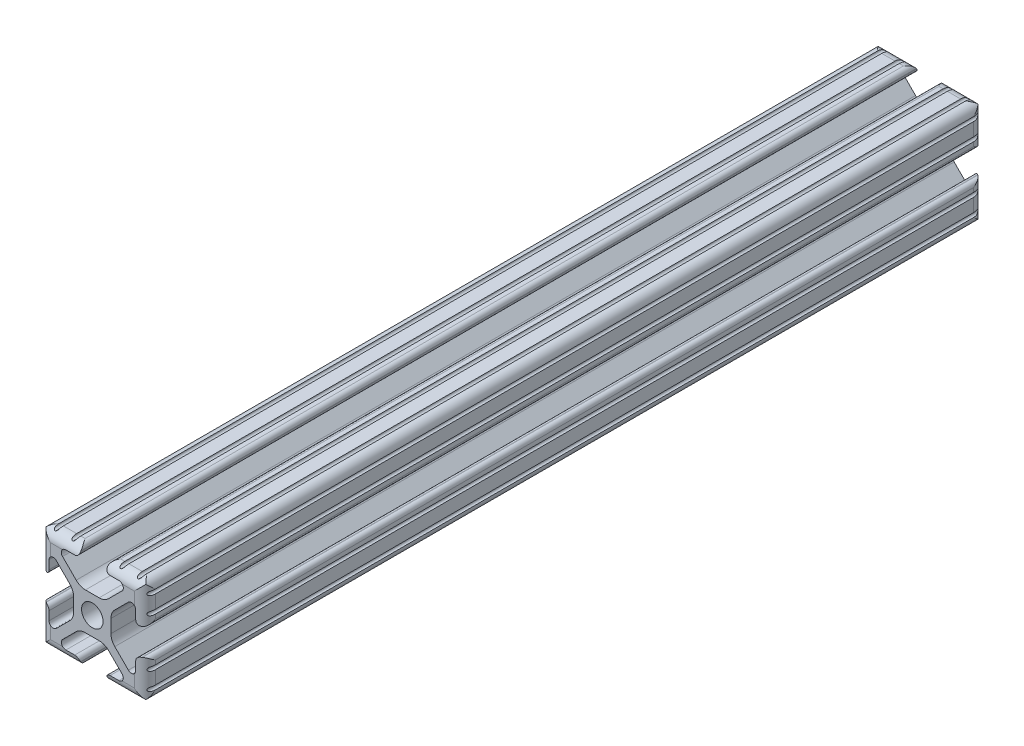
from build123d import *

# Parameters (mm, degrees)
SKETCH1_R           = 2.6035
BOSS_EXTRUDE1_DEPTH = 101.6
FILLET1_R           = 2.54
SKETCH3_R           = 3.175
CUT_EXTRUDE1_DEPTH  = 106.494123191


with BuildPart() as part:
    # Sketch1 → Boss-Extrude1 (new, symmetric)
    with BuildSketch(Plane.XY):
        with BuildLine():
            Line((-7.179650497, -8.645192506), (-3.952270251, -5.423690499))
            ThreePointArc((-3.952270251, -5.423690499), (-2.922936451, -4.736929036), (-1.709253557, -4.4958))
            Line((-1.709253557, -4.4958), (1.709253557, -4.4958))
            ThreePointArc((1.709253557, -4.4958), (2.922936451, -4.736929036), (3.952270251, -5.423690499))
            Line((3.952270251, -5.423690499), (7.179650497, -8.645192506))
            ThreePointArc((7.179650497, -8.645192506), (7.41473083, -9.822813117), (6.416408329, -10.4902))
            Line((6.416408329, -10.4902), (4.287512407, -10.4902))
            ThreePointArc((4.287512407, -10.4902), (3.54574862, -10.79744862), (3.2385, -11.539212407))
            Line((3.2385, -11.539212407), (3.2385, -11.650987593))
            ThreePointArc((3.2385, -11.650987593), (3.54574862, -12.39275138), (4.287512407, -12.7))
            Line((4.287512407, -12.7), (5.317126718, -12.7))
            ThreePointArc((5.317126718, -12.7), (5.825126718, -12.192), (6.333126718, -12.7))
            Line((6.333126718, -12.7), (9.550443118, -12.7))
            ThreePointArc((9.550443118, -12.7), (10.058366869, -12.192000006), (10.566443095, -12.699847501))
            ThreePointArc((10.566443095, -12.699847501), (12.082537762, -12.08250727), (12.699846982, -10.566399977))
            ThreePointArc((12.699846982, -10.566399977), (12.192000006, -10.058323491), (12.7, -9.5504))
            Line((12.7, -9.5504), (12.7, -6.3330836))
            ThreePointArc((12.7, -6.3330836), (12.192, -5.8250836), (12.7, -5.3170836))
            Line((12.7, -5.3170836), (12.7, -4.287469289))
            ThreePointArc((12.7, -4.287469289), (12.39275138, -3.545705502), (11.650987593, -3.238456882))
            Line((11.650987593, -3.238456882), (11.539212407, -3.238456882))
            ThreePointArc((11.539212407, -3.238456882), (10.79744862, -3.545705502), (10.4902, -4.287469289))
            Line((10.4902, -4.287469289), (10.4902, -6.402089023))
            ThreePointArc((10.4902, -6.402089023), (9.856505071, -7.351067942), (8.737131347, -7.129408934))
            Line((8.737131347, -7.129408934), (5.441005833, -3.840816462))
            ThreePointArc((5.441005833, -3.840816462), (4.750877967, -2.809883091), (4.5085, -1.593185507))
            Line((4.5085, -1.593185507), (4.5085, 1.593185507))
            ThreePointArc((4.5085, 1.593185507), (4.750877967, 2.809883091), (5.441005833, 3.840816462))
            Line((5.441005833, 3.840816462), (8.737131347, 7.129408934))
            ThreePointArc((8.737131347, 7.129408934), (9.856505071, 7.351067942), (10.4902, 6.402089023))
            Line((10.4902, 6.402089023), (10.4902, 4.287469289))
            ThreePointArc((10.4902, 4.287469289), (10.79744862, 3.545705502), (11.539212407, 3.238456882))
            Line((11.539212407, 3.238456882), (11.650987593, 3.238456882))
            ThreePointArc((11.650987593, 3.238456882), (12.39275138, 3.545705502), (12.7, 4.287469289))
            Line((12.7, 4.287469289), (12.7, 5.3170836))
            ThreePointArc((12.7, 5.3170836), (12.192, 5.8250836), (12.7, 6.3330836))
            Line((12.7, 6.3330836), (12.7, 9.5504))
            ThreePointArc((12.7, 9.5504), (12.192000006, 10.058323491), (12.699846982, 10.566399977))
            ThreePointArc((12.699846982, 10.566399977), (12.082537762, 12.08250727), (10.566443095, 12.699847501))
            ThreePointArc((10.566443095, 12.699847501), (10.058366869, 12.192000006), (9.550443118, 12.7))
            Line((9.550443118, 12.7), (6.333126718, 12.7))
            ThreePointArc((6.333126718, 12.7), (5.825126718, 12.192), (5.317126718, 12.7))
            Line((5.317126718, 12.7), (4.287512407, 12.7))
            ThreePointArc((4.287512407, 12.7), (3.54574862, 12.39275138), (3.2385, 11.650987593))
            Line((3.2385, 11.650987593), (3.2385, 11.539212407))
            ThreePointArc((3.2385, 11.539212407), (3.54574862, 10.79744862), (4.287512407, 10.4902))
            Line((4.287512407, 10.4902), (6.476788598, 10.4902))
            ThreePointArc((6.476788598, 10.4902), (7.432222385, 9.85140422), (7.207036008, 8.724370562))
            Line((7.207036008, 8.724370562), (3.898272566, 5.423169045))
            ThreePointArc((3.898272566, 5.423169045), (2.869120213, 4.736787962), (1.655778399, 4.4958))
            Line((1.655778399, 4.4958), (-1.655778399, 4.4958))
            ThreePointArc((-1.655778399, 4.4958), (-2.869120213, 4.736787962), (-3.898272566, 5.423169045))
            Line((-3.898272566, 5.423169045), (-7.207036008, 8.724370562))
            ThreePointArc((-7.207036008, 8.724370562), (-7.432222385, 9.85140422), (-6.476788598, 10.4902))
            Line((-6.476788598, 10.4902), (-4.287512407, 10.4902))
            ThreePointArc((-4.287512407, 10.4902), (-3.54574862, 10.79744862), (-3.2385, 11.539212407))
            Line((-3.2385, 11.539212407), (-3.2385, 11.650987593))
            ThreePointArc((-3.2385, 11.650987593), (-3.54574862, 12.39275138), (-4.287512407, 12.7))
            Line((-4.287512407, 12.7), (-5.317126718, 12.7))
            ThreePointArc((-5.317126718, 12.7), (-5.825126718, 12.192), (-6.333126718, 12.7))
            Line((-6.333126718, 12.7), (-9.550443118, 12.7))
            ThreePointArc((-9.550443118, 12.7), (-10.058366869, 12.192000006), (-10.566443095, 12.699847501))
            ThreePointArc((-10.566443095, 12.699847501), (-12.082537762, 12.08250727), (-12.699846982, 10.566399977))
            ThreePointArc((-12.699846982, 10.566399977), (-12.192000006, 10.058323491), (-12.7, 9.5504))
            Line((-12.7, 9.5504), (-12.7, 6.3330836))
            ThreePointArc((-12.7, 6.3330836), (-12.192, 5.8250836), (-12.7, 5.3170836))
            Line((-12.7, 5.3170836), (-12.7, 4.287469289))
            ThreePointArc((-12.7, 4.287469289), (-12.39275138, 3.545705502), (-11.650987593, 3.238456882))
            Line((-11.650987593, 3.238456882), (-11.539212407, 3.238456882))
            ThreePointArc((-11.539212407, 3.238456882), (-10.79744862, 3.545705502), (-10.4902, 4.287469289))
            Line((-10.4902, 4.287469289), (-10.4902, 6.402089023))
            ThreePointArc((-10.4902, 6.402089023), (-9.856505071, 7.351067942), (-8.737131347, 7.129408934))
            Line((-8.737131347, 7.129408934), (-5.441005833, 3.840816462))
            ThreePointArc((-5.441005833, 3.840816462), (-4.750877967, 2.809883091), (-4.5085, 1.593185507))
            Line((-4.5085, 1.593185507), (-4.5085, -1.593185507))
            ThreePointArc((-4.5085, -1.593185507), (-4.750877967, -2.809883091), (-5.441005833, -3.840816462))
            Line((-5.441005833, -3.840816462), (-8.737131347, -7.129408934))
            ThreePointArc((-8.737131347, -7.129408934), (-9.856505071, -7.351067942), (-10.4902, -6.402089023))
            Line((-10.4902, -6.402089023), (-10.4902, -4.287469289))
            ThreePointArc((-10.4902, -4.287469289), (-10.79744862, -3.545705502), (-11.539212407, -3.238456882))
            Line((-11.539212407, -3.238456882), (-11.650987593, -3.238456882))
            ThreePointArc((-11.650987593, -3.238456882), (-12.39275138, -3.545705502), (-12.7, -4.287469289))
            Line((-12.7, -4.287469289), (-12.7, -5.3170836))
            ThreePointArc((-12.7, -5.3170836), (-12.192, -5.8250836), (-12.7, -6.3330836))
            Line((-12.7, -6.3330836), (-12.7, -9.5504))
            ThreePointArc((-12.7, -9.5504), (-12.192000006, -10.058323491), (-12.699846982, -10.566399977))
            ThreePointArc((-12.699846982, -10.566399977), (-12.082537762, -12.08250727), (-10.566443095, -12.699847501))
            ThreePointArc((-10.566443095, -12.699847501), (-10.058366869, -12.192000006), (-9.550443118, -12.7))
            Line((-9.550443118, -12.7), (-6.333126718, -12.7))
            ThreePointArc((-6.333126718, -12.7), (-5.825126718, -12.192), (-5.317126718, -12.7))
            Line((-5.317126718, -12.7), (-4.287512407, -12.7))
            ThreePointArc((-4.287512407, -12.7), (-3.54574862, -12.39275138), (-3.2385, -11.650987593))
            Line((-3.2385, -11.650987593), (-3.2385, -11.539212407))
            ThreePointArc((-3.2385, -11.539212407), (-3.54574862, -10.79744862), (-4.287512407, -10.4902))
            Line((-4.287512407, -10.4902), (-6.416408329, -10.4902))
            ThreePointArc((-6.416408329, -10.4902), (-7.41473083, -9.822813117), (-7.179650497, -8.645192506))
        make_face()
        Circle(SKETCH1_R, mode=Mode.SUBTRACT)
    extrude(amount=BOSS_EXTRUDE1_DEPTH, both=True)

    # Fillet1
    # the kernel refuses this fillet: 2.54 mm, written as the material it takes off along each edge
    with BuildSketch(Plane(origin=(-12.7, 15.9004, 101.6), x_dir=(0, 0, -1), z_dir=(0, -1, 0)), Plane(origin=(0.016873282, 12.7, 101.6), x_dir=(0, 0, -1), z_dir=(-1, 0, 0)), Plane(origin=(15.900443118, 12.7, 101.6), x_dir=(0, 0, -1), z_dir=(-1, 0, 0)), Plane(origin=(12.7, -0.0169164, 101.6), x_dir=(0, 0, -1), z_dir=(0, 1, 0)), Plane(origin=(12.7, -15.9004, 101.6), x_dir=(0, 0, -1), z_dir=(0, 1, 0)), Plane(origin=(-0.016873282, -12.7, 101.6), x_dir=(0, 0, -1), z_dir=(1, 0, 0)), Plane(origin=(-15.900443118, -12.7, 101.6), x_dir=(0, 0, -1), z_dir=(1, 0, 0)), Plane(origin=(-12.7, 0.0169164, 101.6), x_dir=(0, 0, -1), z_dir=(0, -1, 0))) as fillet1_piece_1:
        with BuildLine():
            CenterArc((FILLET1_R, FILLET1_R), FILLET1_R, 180, 90)
            Line((0, FILLET1_R), (0, 0))
            Line((0, 0), (FILLET1_R, 0))
        make_face()
    extrude(amount=15.9173164, mode=Mode.SUBTRACT)
    with BuildSketch(Plane(origin=(12.7, -0.0169164, -101.6), x_dir=(0, 0, 1), z_dir=(0, 1, 0)), Plane(origin=(12.7, -15.9004, -101.6), x_dir=(0, 0, 1), z_dir=(0, 1, 0)), Plane(origin=(-0.016873282, -12.7, -101.6), x_dir=(0, 0, 1), z_dir=(1, 0, 0)), Plane(origin=(-15.900443118, -12.7, -101.6), x_dir=(0, 0, 1), z_dir=(1, 0, 0)), Plane(origin=(-12.7, 0.0169164, -101.6), x_dir=(0, 0, 1), z_dir=(0, -1, 0)), Plane(origin=(-12.7, 15.9004, -101.6), x_dir=(0, 0, 1), z_dir=(0, -1, 0)), Plane(origin=(0.016873282, 12.7, -101.6), x_dir=(0, 0, 1), z_dir=(-1, 0, 0)), Plane(origin=(15.900443118, 12.7, -101.6), x_dir=(0, 0, 1), z_dir=(-1, 0, 0))) as fillet1_piece_2:
        with BuildLine():
            CenterArc((FILLET1_R, -FILLET1_R), FILLET1_R, 90, 90)
            Line((0, -FILLET1_R), (0, 0))
            Line((0, 0), (FILLET1_R, 0))
        make_face()
    extrude(amount=15.9173164, mode=Mode.SUBTRACT)

    # Sketch3 → Cut-Extrude1 (cut, through all)
    with BuildSketch(Plane.ZY.offset(12.7)):
        with Locations(Location((69.85, 0, 0), (0, 0, 329.88145664))):
            Circle(SKETCH3_R)
        with Locations(Location((50.8, 0, 0), (0, 0, 329.88145664))):
            Circle(SKETCH3_R)
    extrude(amount=-CUT_EXTRUDE1_DEPTH, mode=Mode.SUBTRACT)


solid = part.part
